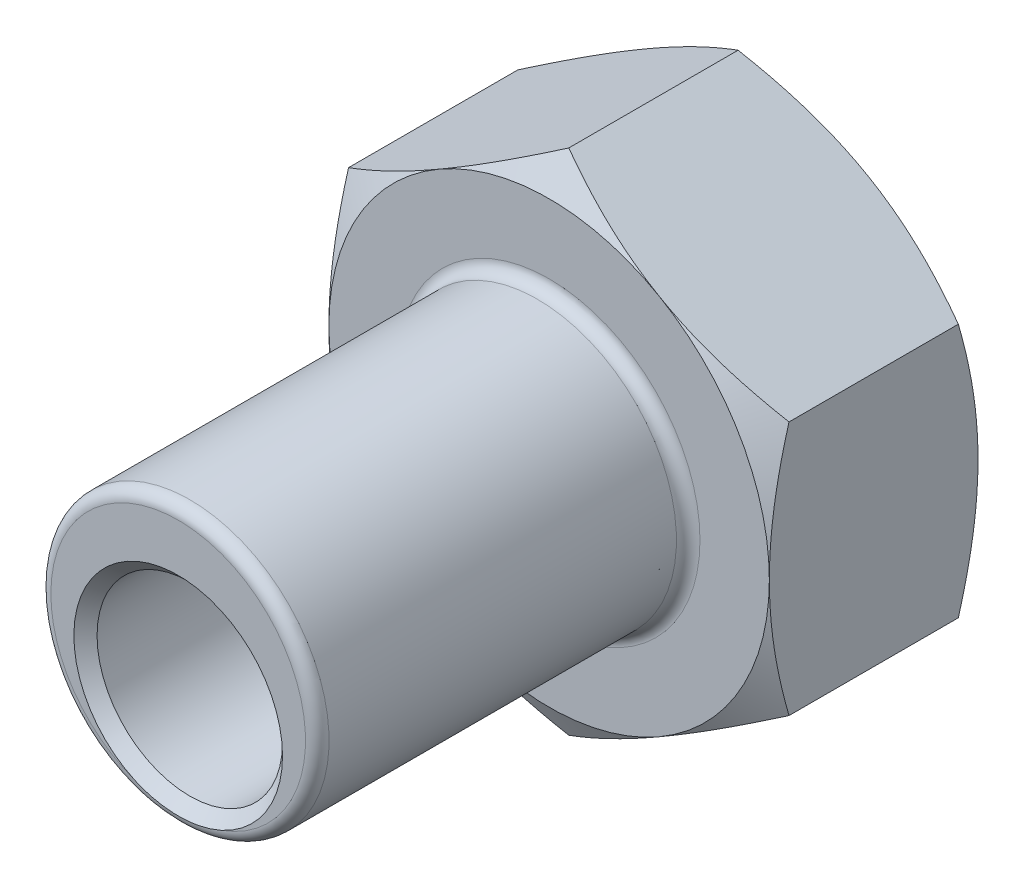
from build123d import *

# Parameters (mm, degrees)
HEX_EXTRUDE_DEPTH        = 9
SKETCH4_OUTSIDE_W        = 132.26
SKETCH4_OUTSIDE_H        = 135.2
SKETCH4_OUTSIDE_R        = 9.5
HEX_CUT1_DEPTH           = 29.906458333
HEX_CUT1_DRAFT           = -60
SKETCH5_OUTSIDE_W        = 106.952
SKETCH5_OUTSIDE_H        = 109.892
SKETCH5_OUTSIDE_R        = 9.5
HEX_CUT2_DEPTH           = 22.600540117
HEX_CUT2_DRAFT           = -60
SKETCH6_R                = 4
ECCENTRIC_HOLE_CUT_DEPTH = 29.906458333
FILLET_2_R               = 0.508
CHAMFER_2_SIZE           = 0.5


with BuildPart() as part:
    # Sketch2 → Body Revolve (revolve)
    with BuildSketch(Plane(origin=(0, 0, 0), x_dir=(0, 0, -1), z_dir=(1, 0, 0)), mode=Mode.PRIVATE) as body_revolve_sk:
        Polygon((-12.5, 0), (12.5, 0), (12.5, 9.5), (3.5, 9.5), (3.5, 6), (-12.5, 6), align=None)
    revolve(body_revolve_sk.sketch.rotate(Axis((0, 0, 12.5), (0, 0, -1)), 90), axis=Axis((0, 0, 12.5), (0, 0, -1)))

    # Sketch3 → Hex Extrude (add)
    with BuildSketch(Plane(origin=(0, 0, -12.5), x_dir=(-1, 0, 0), z_dir=(0, 0, -1))):
        Polygon((0, 10.969655115), (-9.5, 5.484827557), (-9.5, -5.484827557), (0, -10.969655115), (9.5, -5.484827557), (9.5, 5.484827557), align=None)
    extrude(amount=-HEX_EXTRUDE_DEPTH)


with BuildPart() as hex_cut1_tool:
    # Sketch4 outside → Hex Cut1 (with draft: the straight prism first)
    with BuildSketch(Plane(origin=(0, 0, -12.5), x_dir=(-1, 0, 0), z_dir=(0, 0, -1))):
        Rectangle(SKETCH4_OUTSIDE_W, SKETCH4_OUTSIDE_H)
        Circle(SKETCH4_OUTSIDE_R, mode=Mode.SUBTRACT)
    extrude(amount=-HEX_CUT1_DEPTH)
    # Hex Cut1: the draft: its side faces are tilted about the plane it starts from
    hex_cut1_sides = [hex_cut1_tool.faces().sort_by_distance(p)[0] for p in [
        (0, -67.6, 2.453229166),
        (-66.13, 0, 2.453229166),
        (0, 67.6, 2.453229166),
        (66.13, 0, 2.453229166),
        (9.5, 0, 2.453229166),
    ]]
    draft(hex_cut1_sides, Plane(origin=(0, 0, -12.5), x_dir=(-1, 0, 0), z_dir=(0, 0, -1)), HEX_CUT1_DRAFT)


with BuildPart() as part_1:
    add(part.part)

    # Hex Cut1: cut by hex_cut1_tool
    add(hex_cut1_tool.part, mode=Mode.SUBTRACT)


with BuildPart() as hex_cut2_tool:
    # Sketch5 outside → Hex Cut2 (with draft: the straight prism first)
    with BuildSketch(Plane.XY.offset(-3.5)):
        Rectangle(SKETCH5_OUTSIDE_W, SKETCH5_OUTSIDE_H)
        Circle(SKETCH5_OUTSIDE_R, mode=Mode.SUBTRACT)
    extrude(amount=-HEX_CUT2_DEPTH)
    # Hex Cut2: the draft: its side faces are tilted about the plane it starts from
    hex_cut2_sides = [hex_cut2_tool.faces().sort_by_distance(p)[0] for p in [
        (0, -54.946, -14.800270058),
        (53.476, 0, -14.800270058),
        (0, 54.946, -14.800270058),
        (-53.476, 0, -14.800270058),
        (-9.5, 0, -14.800270058),
    ]]
    draft(hex_cut2_sides, Plane.XY.offset(-3.5), HEX_CUT2_DRAFT)


with BuildPart() as part_2:
    add(part_1.part)

    # Hex Cut2: cut by hex_cut2_tool
    add(hex_cut2_tool.part, mode=Mode.SUBTRACT)

    # Sketch6 → Eccentric Hole Cut (cut, through all)
    with BuildSketch(Plane.XY.offset(12.5)):
        with Locations((0, -1.07)):
            Circle(SKETCH6_R)
    extrude(amount=-ECCENTRIC_HOLE_CUT_DEPTH, mode=Mode.SUBTRACT)

    # Fillet 2
    fillet_2_edges = [part_2.edges().sort_by_distance(p)[0] for p in [
        (-6, 0, 12.5),
        (-6, 0, -3.5),
    ]]
    fillet(fillet_2_edges, radius=FILLET_2_R)

    # Chamfer 2
    # the kernel refuses this chamfer: 0.5 mm, written as the material it takes off along each edge
    with BuildSketch(Plane(origin=(0, -1.07, -12.5), x_dir=(1, 0, 0), z_dir=(0, -1, 0))) as chamfer_2_piece_1:
        Polygon((4, CHAMFER_2_SIZE), (4 + CHAMFER_2_SIZE, 0), (4, 0), align=None)
    revolve(axis=Axis((0, -1.07, -12.5), (0, 0, 1)), mode=Mode.SUBTRACT)
    with BuildSketch(Plane(origin=(0, -1.07, 12.5), x_dir=(1, 0, 0), z_dir=(0, -1, 0))) as chamfer_2_piece_2:
        Polygon((4 + CHAMFER_2_SIZE, 0), (4, -CHAMFER_2_SIZE), (4, 0), align=None)
    revolve(axis=Axis((0, -1.07, 12.5), (0, 0, 1)), mode=Mode.SUBTRACT)


solid = part_2.part
